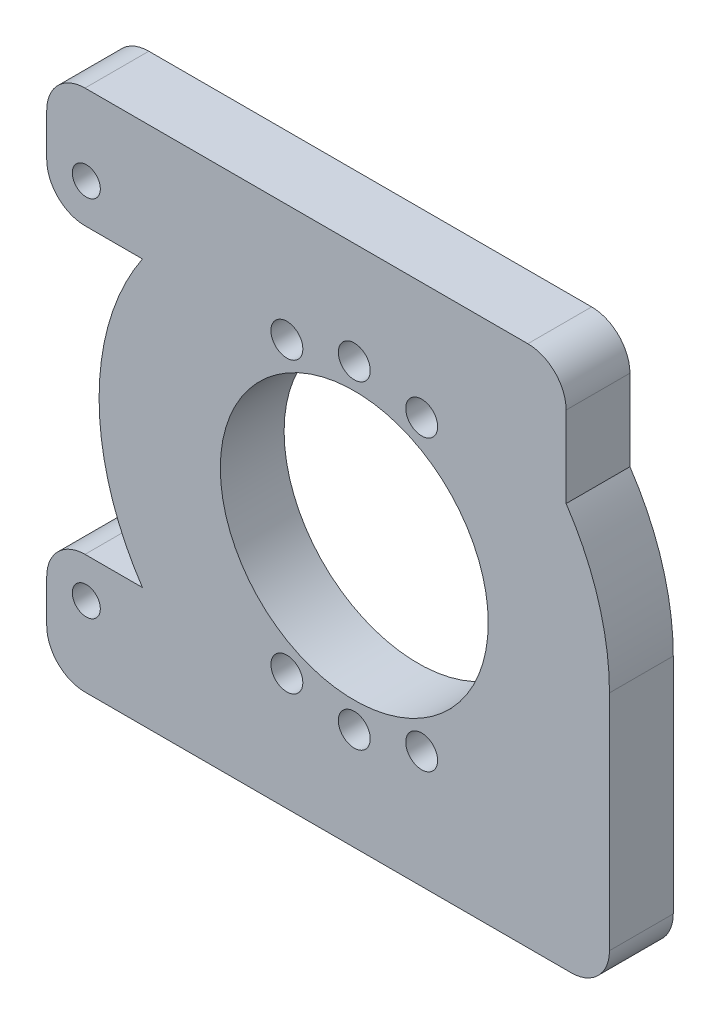
from build123d import *

# Parameters (mm, degrees)
SKETCH1_R           = 21
SKETCH1_R_2         = 2.5
SKETCH1_R_3         = 2.2
BOSS_EXTRUDE3_DEPTH = 10


with BuildPart() as part:
    # Sketch1 → Boss-Extrude3 (new body)
    with BuildSketch(Plane.XY):
        with BuildLine():
            Line((-33.207077559, 22.3), (-42.207077559, 22.3))
            ThreePointArc((-42.207077559, 22.3), (-46.449718246, 24.057359313), (-48.207077559, 28.3))
            Line((-48.207077559, 28.3), (-48.207077559, 30))
            Line((-48.207077559, 30), (-48.207077559, 35))
            ThreePointArc((-48.207077559, 35), (-46.449718246, 39.242640687), (-42.207077559, 41))
            Line((-42.207077559, 41), (0, 41))
            Line((0, 41), (27.207077559, 41))
            ThreePointArc((27.207077559, 41), (31.449718246, 39.242640687), (33.207077559, 35))
            Line((33.207077559, 35), (33.207077559, 22.3))
            ThreePointArc((33.207077559, 22.3), (38.264102644, 11.655833253), (40, 0))
            Line((40, 0), (40, -35))
            ThreePointArc((40, -35), (38.242640687, -39.242640687), (34, -41))
            Line((34, -41), (-42.207077559, -41))
            ThreePointArc((-42.207077559, -41), (-46.449718246, -39.242640687), (-48.207077559, -35))
            Line((-48.207077559, -35), (-48.207077559, -34.7))
            Line((-48.207077559, -34.7), (-48.207077559, -30))
            Line((-48.207077559, -30), (-48.207077559, -28.3))
            ThreePointArc((-48.207077559, -28.3), (-46.449718246, -24.057359313), (-42.207077559, -22.3))
            Line((-42.207077559, -22.3), (-33.207077559, -22.3))
            ThreePointArc((-33.207077559, -22.3), (-40, 0), (-33.207077559, 22.3))
        make_face()
        Circle(SKETCH1_R, mode=Mode.SUBTRACT)
        with Locations((0, 25)):
            Circle(SKETCH1_R_2, mode=Mode.SUBTRACT)
        with Locations((10.565456544, 22.657694676)):
            Circle(SKETCH1_R_2, mode=Mode.SUBTRACT)
        with Locations((-10.565456544, 22.657694676)):
            Circle(SKETCH1_R_2, mode=Mode.SUBTRACT)
        with Locations((-10.565456544, -22.657694676)):
            Circle(SKETCH1_R_2, mode=Mode.SUBTRACT)
        with Locations((0, -25)):
            Circle(SKETCH1_R_2, mode=Mode.SUBTRACT)
        with Locations((10.565456544, -22.657694676)):
            Circle(SKETCH1_R_2, mode=Mode.SUBTRACT)
        with Locations((-42.007077559, 28.5)):
            Circle(SKETCH1_R_3, mode=Mode.SUBTRACT)
        with Locations((-42.007077559, -28.5)):
            Circle(SKETCH1_R_3, mode=Mode.SUBTRACT)
    extrude(amount=BOSS_EXTRUDE3_DEPTH)


solid = part.part
